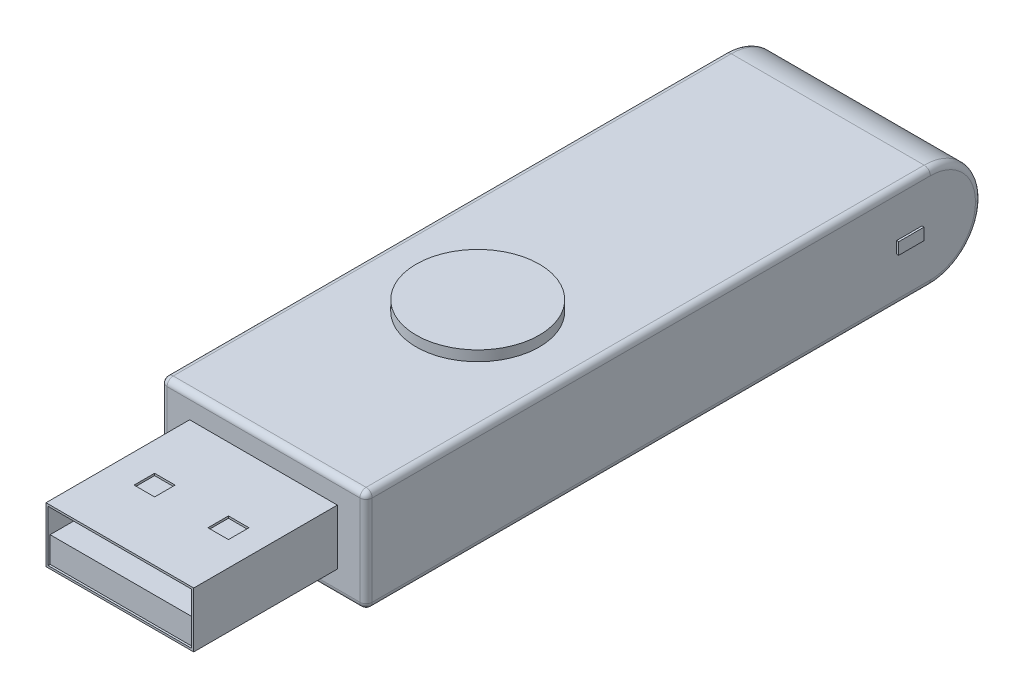
from build123d import *

# Parameters (mm, degrees)
SKETCH1_W           = 25.4
SKETCH1_H           = 12.7
BOSS_EXTRUDE1_DEPTH = 76.2
FILLET1_R           = 6.35
SKETCH3_W           = 18.288
SKETCH3_H           = 6.858
SKETCH3_W_2         = 17.78
SKETCH3_H_2         = 6.35
BOSS_EXTRUDE2_DEPTH = 17.78
SKETCH4_W           = 17.78
SKETCH4_H           = 3.175
BOSS_EXTRUDE3_DEPTH = 17.526
SKETCH5_W           = 2.54
SKETCH5_H           = 2.54
CUT_EXTRUDE1_DEPTH  = 0.254
SKETCH7_W           = 2.54
SKETCH7_H           = 2.54
CUT_EXTRUDE6_DEPTH  = 0.254
FILLET2_R           = 0.762
FILLET3_R           = 0.762
SKETCH20_R          = 7.62
BOSS_EXTRUDE4_DEPTH = 1.27
BOSS_EXTRUDE5_START = 1.27
SKETCH21_R          = 7.62
BOSS_EXTRUDE5_DEPTH = 1.27
SKETCH23_W          = 3.136693438
SKETCH23_H          = 1.456321954
BOSS_EXTRUDE6_DEPTH = 0.254


with BuildPart() as part:
    # Sketch1 → Boss-Extrude1 (new body)
    with BuildSketch(Plane.XY):
        Rectangle(SKETCH1_W, SKETCH1_H)
    extrude(amount=BOSS_EXTRUDE1_DEPTH)

    # Fillet1
    fillet1_edges = [part.edges().sort_by_distance(p)[0] for p in [
        (0, 6.35, 0),
        (0, -6.35, 0),
    ]]
    fillet(fillet1_edges, radius=FILLET1_R - 0.0001)  # a hair under: the kernel refuses the full size

    # Sketch3 → Boss-Extrude2 (add)
    with BuildSketch(Plane.XY.offset(76.2)):
        Rectangle(SKETCH3_W, SKETCH3_H)
        Rectangle(SKETCH3_W_2, SKETCH3_H_2, mode=Mode.SUBTRACT)
    extrude(amount=BOSS_EXTRUDE2_DEPTH)

    # Sketch4 → Boss-Extrude3 (add)
    with BuildSketch(Plane.XY.offset(76.2)):
        with Locations((0, -1.5875)):
            Rectangle(SKETCH4_W, SKETCH4_H)
    extrude(amount=BOSS_EXTRUDE3_DEPTH)

    # Sketch5 → Cut-Extrude1 (cut)
    with BuildSketch(Plane(origin=(0, 3.429, 0), x_dir=(1, 0, 0), z_dir=(0, 1, 0))):
        with Locations((4.832637326, -85.369889154)):
            Rectangle(SKETCH5_W, SKETCH5_H)
        with Locations((-4.311362674, -85.369889154)):
            Rectangle(SKETCH5_W, SKETCH5_H)
    extrude(amount=-CUT_EXTRUDE1_DEPTH, mode=Mode.SUBTRACT)

    # Sketch7 → Cut-Extrude6 (cut)
    with BuildSketch(Plane.XZ.offset(3.429)):
        with Locations((4.832637326, 85.369889154)):
            Rectangle(SKETCH7_W, SKETCH7_H)
        with Locations((-4.311362674, 85.369889154)):
            Rectangle(SKETCH7_W, SKETCH7_H)
    extrude(amount=-CUT_EXTRUDE6_DEPTH, mode=Mode.SUBTRACT)

    # Fillet2
    fillet2_edges = [part.edges().sort_by_distance(p)[0] for p in [
        (-12.7, -4.49015735, 1.85984265),
        (-12.7, 4.49015735, 1.85984265),
        (12.7, -4.49015735, 1.85984265),
        (12.7, 4.49015735, 1.85984265),
        (12.7, -6.35, 41.27495),
        (-12.7, -6.35, 41.27495),
        (-12.7, 6.35, 41.27495),
        (12.7, 6.35, 41.27495),
    ]]
    fillet(fillet2_edges, radius=FILLET2_R)

    # Fillet3
    fillet3_edges = [part.edges().sort_by_distance(p)[0] for p in [
        (0, -6.35, 76.2),
        (-12.7, 0, 76.2),
        (12.7, 0, 76.2),
        (0, 6.35, 76.2),
        (12.476815367, 6.126815367, 76.2),
        (-12.476815367, 6.126815367, 76.2),
        (12.476815367, -6.126815367, 76.2),
        (-12.476815367, -6.126815367, 76.2),
    ]]
    fillet(fillet3_edges, radius=FILLET3_R)

    # Sketch20 → Boss-Extrude4 (add)
    with BuildSketch(Plane(origin=(0, 6.35, 0), x_dir=(1, 0, 0), z_dir=(0, 1, 0))):
        with Locations(Location((0, -49.676760647, 0), (0, 0, 90))):
            Circle(SKETCH20_R)
    extrude(amount=BOSS_EXTRUDE4_DEPTH)

    # Sketch21 → Boss-Extrude5 (add)
    with BuildSketch(Plane.XZ.offset(6.35).offset(BOSS_EXTRUDE5_START)):
        with Locations(Location((0, 49.676760647, 0), (0, 0, 270))):
            Circle(SKETCH21_R)
    extrude(amount=-BOSS_EXTRUDE5_DEPTH)

    # Sketch23 → Boss-Extrude6 (add)
    with BuildSketch(Plane(origin=(12.7, 0, 0), x_dir=(0, 0, -1), z_dir=(1, 0, 0))):
        with Locations((-8.954865749, 0)):
            Rectangle(SKETCH23_W, SKETCH23_H)
    extrude(amount=BOSS_EXTRUDE6_DEPTH)


solid = part.part
